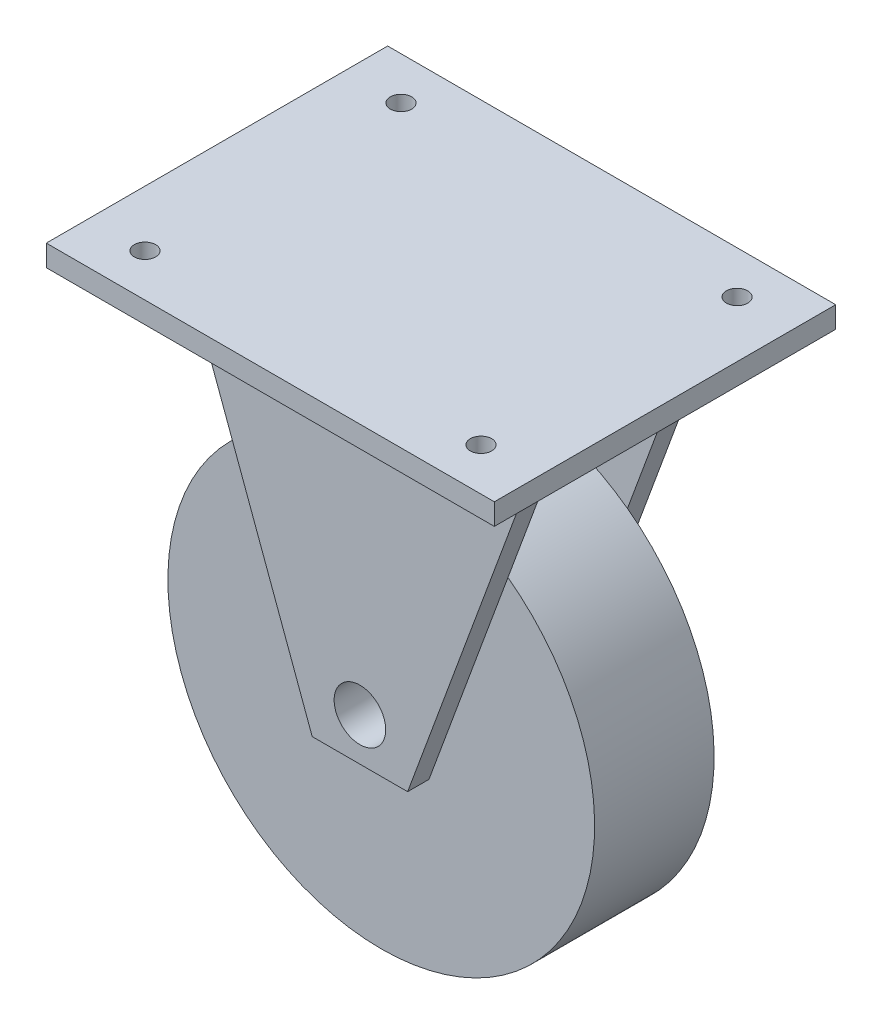
from build123d import *

# Parameters (mm, degrees)
SKETCH_1_W             = 105
SKETCH_1_H             = 80
SKETCH_1_R             = 2.5
EXTRUDE_1_DEPTH        = 5
EXTRUDE_START          = -14
SKETCH_2_R             = 50
EXTRUDE_2_DEPTH        = 28
EXTRUDE_3_DEPTH        = 5
PATTERN_LINEAR_1_COUNT = 2
PATTERN_LINEAR_1_PITCH = 33
SKETCH_4_R             = 6.044924725
CUT_EXTRUDE_1_DEPTH    = 148.858885428


with BuildPart() as part:
    # Эскиз1 → Бобышка-Вытянуть1 (new body)
    with BuildSketch(Plane(origin=(0, 0, 0), x_dir=(1, 0, 0), z_dir=(0, 1, 0))):
        Rectangle(SKETCH_1_W, SKETCH_1_H)
        with Locations((-39.375, 30)):
            Circle(SKETCH_1_R, mode=Mode.SUBTRACT)
        with Locations((39.375, 30)):
            Circle(SKETCH_1_R, mode=Mode.SUBTRACT)
        with Locations((39.375, -30)):
            Circle(SKETCH_1_R, mode=Mode.SUBTRACT)
        with Locations((-39.375, -30)):
            Circle(SKETCH_1_R, mode=Mode.SUBTRACT)
    extrude(amount=EXTRUDE_1_DEPTH)



with BuildPart() as body_2:
    # Эскиз2 → Бобышка-Вытянуть2 (new body)
    with BuildSketch(Plane.XY.offset(EXTRUDE_START)):
        with Locations((0, -75)):
            Circle(SKETCH_2_R)
    extrude(amount=EXTRUDE_2_DEPTH)


with BuildPart() as part_1:
    add(part.part)

    add(body_2.part)  # Бобышка-Вытянуть3 merges body 2
    # Эскиз3 → Бобышка-Вытянуть3 (add)
    with BuildSketch(Plane.XY.offset(14)):
        Polygon((-11.180339887, -85), (11.180339887, -85), (42.5, 0), (-42.5, 0), align=None)
    extrude_3 = extrude(amount=EXTRUDE_3_DEPTH)

    # Линейный массив1: Бобышка-Вытянуть3 ×2
    with Locations(*[(0, 0, -i * PATTERN_LINEAR_1_PITCH) for i in range(1, PATTERN_LINEAR_1_COUNT)]):
        add(extrude_3)

    # Эскиз4 → Вырез-Вытянуть1 (cut, through all)
    with BuildSketch(Plane(origin=(0, 0, -19), x_dir=(-1, 0, 0), z_dir=(0, 0, -1))):
        with Locations((0, -75)):
            Circle(SKETCH_4_R)
    extrude(amount=-CUT_EXTRUDE_1_DEPTH, mode=Mode.SUBTRACT)


solid = part_1.part
